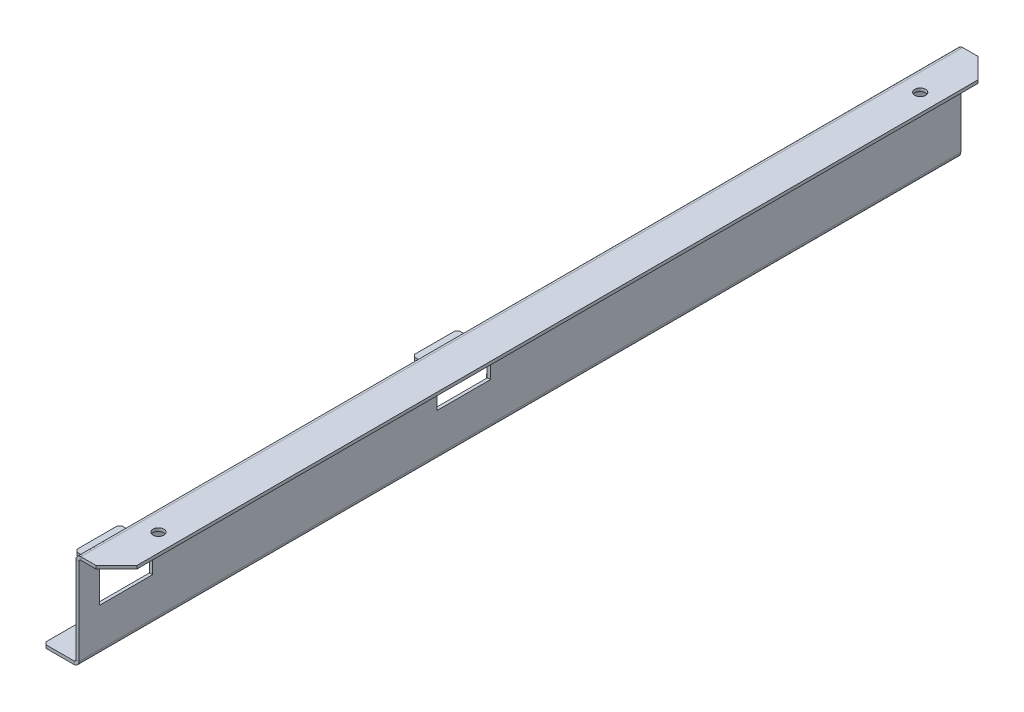
from build123d import *

# Parameters (mm, degrees)
SKETCH2_W                            = 16
SKETCH2_H                            = 38.1
BOSS_EXTRUDE1_DEPTH                  = 173.482
CONVERT_SOLID1_START                 = -173.482
CONVERT_SOLID1_DEPTH                 = 346.964
EDGE_FLANGE2_STRIP_W                 = 6.4008
EDGE_FLANGE2_STRIP_H                 = 1.2192
EDGE_FLANGE2_STRIP_CUT_DEPTH         = 346.964
EDGE_FLANGE2_DEPTH                   = 346.964
EDGE_FLANGE3_STRIP_W                 = 6.4008
EDGE_FLANGE3_STRIP_H                 = 1.2192
EDGE_FLANGE3_STRIP_CUT_DEPTH         = 172.6946
EDGE_FLANGE3_RELIEF_W                = 7.1628
EDGE_FLANGE3_RELIEF_H                = 1.6002
EDGE_FLANGE3_RELIEF_CUT_DEPTH        = 1.2192
EDGE_FLANGE3_DEPTH                   = 172.6946
PEM_CLEARANCE_HOLES_R                = 2.3876
CUT_EXTRUDE4_DEPTH                   = 179.335678775
TOP_PLATE_ATTACHMENT_PEM_HOLES_R     = 2.1082
CUT_EXTRUDE5_DEPTH                   = 179.335678775
CHAMFER2_SIZE                        = 8
SKETCH17_W                           = 20.9804
SKETCH17_H                           = 12.1158
CUT_EXTRUDE7_DEPTH                   = 1.2192
EDGE_FLANGE4_STRIP_W                 = 6.4008
EDGE_FLANGE4_STRIP_H                 = 1.2192
EDGE_FLANGE4_STRIP_CUT_DEPTH         = 17.78
EDGE_FLANGE4_RELIEF_W                = 7.1628
EDGE_FLANGE4_RELIEF_H                = 1.6002
EDGE_FLANGE4_RELIEF_CUT_DEPTH        = 1.2192
EDGE_FLANGE4_STRIP_2_W               = 6.4008
EDGE_FLANGE4_STRIP_2_H               = 1.2192
EDGE_FLANGE4_STRIP_CUT_2_DEPTH       = 17.78
EDGE_FLANGE4_RELIEF_2_W              = 7.1628
EDGE_FLANGE4_RELIEF_2_H              = 1.6002
EDGE_FLANGE4_RELIEF_CUT_2_DEPTH      = 1.2192
EDGE_FLANGE4_DEPTH                   = 17.78
EDGE_FLANGE4_BEND_DEPTH              = 17.78
BASE_MOUNTING_RIVET_CLAMPING_HOLES_R = 1.6637
CUT_EXTRUDE8_DEPTH                   = 1.2192
SKETCH29_R                           = 1.905
CUT_EXTRUDE11_DEPTH                  = 179.335678775
CHAMFER3_SIZE                        = 1.016


# Read off the part's stored shape, not the designer's step: Convert-Solid1
# Sheet-metal steps are written as plain solids
with BuildPart() as part:
    # Sketch2 → Boss-Extrude1 (new, symmetric)
    with BuildSketch(Plane.XY):
        with Locations((8, 19.05)):
            Rectangle(SKETCH2_W, SKETCH2_H)
    extrude(amount=BOSS_EXTRUDE1_DEPTH, both=True)

    # Convert-Solid1 outline → Convert-Solid1 (cut)
    with BuildSketch(Plane.XY.offset(CONVERT_SOLID1_START)):
        with BuildLine():
            Line((0, 38.1), (0, 36.1188))
            ThreePointArc((0, 36.1188), (0.580280045, 37.519719955), (1.9812, 38.1))
            Line((1.9812, 38.1), (0, 38.1))
        make_face()
        with BuildLine():
            Line((1.2192, 36.1188), (1.2192, 0))
            Line((1.2192, 0), (16, 0))
            Line((16, 0), (16, 36.8808))
            Line((16, 36.8808), (1.9812, 36.8808))
            ThreePointArc((1.9812, 36.8808), (1.442384633, 36.657615367), (1.2192, 36.1188))
        make_face()
    extrude(amount=CONVERT_SOLID1_DEPTH, mode=Mode.SUBTRACT)

    # Edge-Flange2 strip (across the edge) → Edge-Flange2 strip cut (cut)
    with BuildSketch(Plane(origin=(0, 0, -173.482), x_dir=(0, 1, 0), z_dir=(0, 0, 1))):
        with Locations((-1.2192, -0.6096)):
            Rectangle(EDGE_FLANGE2_STRIP_W, EDGE_FLANGE2_STRIP_H)
    extrude(amount=EDGE_FLANGE2_STRIP_CUT_DEPTH, mode=Mode.SUBTRACT)

    # Edge-Flange2 section (across the edge) → Edge-Flange2 (add)
    with BuildSketch(Plane(origin=(0, 0, -173.482), x_dir=(0, 1, 0), z_dir=(0, 0, 1))):
        with BuildLine():
            Line((0, 0.762), (0, 12.7508))
            Line((0, 12.7508), (1.2192, 12.7508))
            Line((1.2192, 12.7508), (1.2192, 0.762))
            ThreePointArc((1.2192, 0.762), (1.442384633, 0.223184633), (1.9812, 0))
            Line((1.9812, 0), (1.9812, -1.2192))
            ThreePointArc((1.9812, -1.2192), (0.580280045, -0.638919955), (0, 0.762))
        make_face()
    extrude(amount=EDGE_FLANGE2_DEPTH)

    # Edge-Flange3 strip (across the edge) → Edge-Flange3 strip cut (cut)
    with BuildSketch(Plane(origin=(-12.7508, 1.2192, -173.482), x_dir=(1, 0, 0), z_dir=(0, 0, 1))):
        with Locations((-1.2192, -0.6096)):
            Rectangle(EDGE_FLANGE3_STRIP_W, EDGE_FLANGE3_STRIP_H)
    extrude(amount=EDGE_FLANGE3_STRIP_CUT_DEPTH, mode=Mode.SUBTRACT)

    # Edge-Flange3 relief (on the sheet) → Edge-Flange3 relief cut (cut)
    with BuildSketch(Plane(origin=(-10.7696, 1.2192, -173.482), x_dir=(1, 0, 0), z_dir=(0, 1, 0))):
        with Locations((-2.8194, -173.4947)):
            Rectangle(EDGE_FLANGE3_RELIEF_W, EDGE_FLANGE3_RELIEF_H)
    extrude(amount=-EDGE_FLANGE3_RELIEF_CUT_DEPTH, mode=Mode.SUBTRACT)

    # Edge-Flange3 section (across the edge) → Edge-Flange3 (add)
    with BuildSketch(Plane(origin=(-12.7508, 1.2192, -173.482), x_dir=(1, 0, 0), z_dir=(0, 0, 1))):
        with BuildLine():
            Line((0, 0.762), (0, 5.6388))
            Line((0, 5.6388), (1.2192, 5.6388))
            Line((1.2192, 5.6388), (1.2192, 0.762))
            ThreePointArc((1.2192, 0.762), (1.442384633, 0.223184633), (1.9812, 0))
            Line((1.9812, 0), (1.9812, -1.2192))
            ThreePointArc((1.9812, -1.2192), (0.580280045, -0.638919955), (0, 0.762))
        make_face()
    extrude(amount=EDGE_FLANGE3_DEPTH)

    # PEM Clearance Holes → Cut-Extrude4 (cut, through all)
    with BuildSketch(Plane(origin=(0, 0, 0), x_dir=(1, 0, 0), z_dir=(0, 1, 0))):
        with Locations((-5.588, 22.098)):
            Circle(PEM_CLEARANCE_HOLES_R)
        with Locations((-5.588, 154.94)):
            Circle(PEM_CLEARANCE_HOLES_R)
        with Locations(Location((-5.588, -154.94, 0), (0, 0, 90))):
            Circle(PEM_CLEARANCE_HOLES_R)
        with Locations(Location((-5.588, -22.098, 0), (0, 0, 90))):
            Circle(PEM_CLEARANCE_HOLES_R)
    extrude(amount=CUT_EXTRUDE4_DEPTH, mode=Mode.SUBTRACT)

    # Top Plate Attachment PEM Holes → Cut-Extrude5 (cut, through all)
    with BuildSketch(Plane(origin=(0, 0, 0), x_dir=(1, 0, 0), z_dir=(0, 1, 0))):
        with Locations((8.89, -149.86)):
            Circle(TOP_PLATE_ATTACHMENT_PEM_HOLES_R)
        with Locations(Location((8.89, 149.86, 0), (0, 0, 90))):
            Circle(TOP_PLATE_ATTACHMENT_PEM_HOLES_R)
    extrude(amount=CUT_EXTRUDE5_DEPTH, mode=Mode.SUBTRACT)

    # Chamfer2
    chamfer2_edges = [part.edges().sort_by_distance(p)[0] for p in [
        (16, 37.4904, -173.482),
        (16, 37.4904, 173.482),
    ]]
    chamfer(chamfer2_edges, length=CHAMFER2_SIZE)

    # Sketch17 → Cut-Extrude7 (cut)
    with BuildSketch(Plane(origin=(0, 0, 0), x_dir=(0, 0, -1), z_dir=(1, 0, 0))):
        with Locations((-22.098, 23.1521)):
            Rectangle(SKETCH17_W, SKETCH17_H)
        with Locations((-154.94, 23.1521)):
            Rectangle(SKETCH17_W, SKETCH17_H)
    extrude(amount=CUT_EXTRUDE7_DEPTH, mode=Mode.SUBTRACT)

    # Edge-Flange4 strip (across the edge) → Edge-Flange4 strip cut (cut)
    with BuildSketch(Plane(origin=(0, 29.21, 13.208), x_dir=(0, 1, 0), z_dir=(0, 0, 1))):
        with Locations((-2.4384, -0.6096)):
            Rectangle(EDGE_FLANGE4_STRIP_W, EDGE_FLANGE4_STRIP_H)
    extrude(amount=EDGE_FLANGE4_STRIP_CUT_DEPTH, mode=Mode.SUBTRACT)

    # Edge-Flange4 relief (on the sheet) → Edge-Flange4 relief cut (cut)
    with BuildSketch(Plane(origin=(0, 29.972, 13.208), x_dir=(0, 1, 0), z_dir=(-1, 0, 0))):
        with Locations((-2.8194, 0.8001)):
            Rectangle(EDGE_FLANGE4_RELIEF_W, EDGE_FLANGE4_RELIEF_H)
        with Locations((-2.8194, -18.5801)):
            Rectangle(EDGE_FLANGE4_RELIEF_W, EDGE_FLANGE4_RELIEF_H)
    extrude(amount=-EDGE_FLANGE4_RELIEF_CUT_DEPTH, mode=Mode.SUBTRACT)

    # Edge-Flange4 strip 2 (across the edge) → Edge-Flange4 strip cut 2 (cut)
    with BuildSketch(Plane(origin=(0, 29.21, 146.05), x_dir=(0, 1, 0), z_dir=(0, 0, 1))):
        with Locations((-2.4384, -0.6096)):
            Rectangle(EDGE_FLANGE4_STRIP_2_W, EDGE_FLANGE4_STRIP_2_H)
    extrude(amount=EDGE_FLANGE4_STRIP_CUT_2_DEPTH, mode=Mode.SUBTRACT)

    # Edge-Flange4 relief 2 (on the sheet) → Edge-Flange4 relief cut 2 (cut)
    with BuildSketch(Plane(origin=(0, 29.972, 146.05), x_dir=(0, 1, 0), z_dir=(-1, 0, 0))):
        with Locations((-2.8194, 0.8001)):
            Rectangle(EDGE_FLANGE4_RELIEF_2_W, EDGE_FLANGE4_RELIEF_2_H)
        with Locations((-2.8194, -18.5801)):
            Rectangle(EDGE_FLANGE4_RELIEF_2_W, EDGE_FLANGE4_RELIEF_2_H)
    extrude(amount=-EDGE_FLANGE4_RELIEF_CUT_2_DEPTH, mode=Mode.SUBTRACT)

    # Edge-Flange4 section (across the edge) → Edge-Flange4 (add)
    with BuildSketch(Plane(origin=(0, 29.21, 13.208), x_dir=(0, 1, 0), z_dir=(0, 0, 1))):
        with BuildLine():
            Line((-1.2192, 0.762), (-1.2192, 10.2108))
            Line((-1.2192, 10.2108), (0, 10.2108))
            Line((0, 10.2108), (0, 0.762))
            ThreePointArc((0, 0.762), (0.223184633, 0.223184633), (0.762, 0))
            Line((0.762, 0), (0.762, -1.2192))
            ThreePointArc((0.762, -1.2192), (-0.638919955, -0.638919955), (-1.2192, 0.762))
        make_face()
    extrude(amount=EDGE_FLANGE4_DEPTH)

    # Edge-Flange4 section 2 (across the edge) → Edge-Flange4 bend (add)
    with BuildSketch(Plane(origin=(0, 29.21, 146.05), x_dir=(0, 1, 0), z_dir=(0, 0, 1))):
        with BuildLine():
            Line((-1.2192, 0.762), (-1.2192, 10.2108))
            Line((-1.2192, 10.2108), (0, 10.2108))
            Line((0, 10.2108), (0, 0.762))
            ThreePointArc((0, 0.762), (0.223184633, 0.223184633), (0.762, 0))
            Line((0.762, 0), (0.762, -1.2192))
            ThreePointArc((0.762, -1.2192), (-0.638919955, -0.638919955), (-1.2192, 0.762))
        make_face()
    extrude(amount=EDGE_FLANGE4_BEND_DEPTH)

    # Base Mounting Rivet Clamping Holes → Cut-Extrude8 (cut)
    with BuildSketch(Plane(origin=(0, 0, 0), x_dir=(1, 0, 0), z_dir=(0, 1, 0))):
        with Locations(Location((-5.588, -165.1, 0), (0, 0, 90))):
            Circle(BASE_MOUNTING_RIVET_CLAMPING_HOLES_R)
        with Locations(Location((-5.588, 0, 0), (0, 0, 270))):
            Circle(BASE_MOUNTING_RIVET_CLAMPING_HOLES_R)
        with Locations(Location((-5.588, 165.1, 0), (0, 0, 270))):
            Circle(BASE_MOUNTING_RIVET_CLAMPING_HOLES_R)
    extrude(amount=CUT_EXTRUDE8_DEPTH, mode=Mode.SUBTRACT)

    # Sketch29 → Cut-Extrude11 (cut, through all)
    with BuildSketch(Plane(origin=(0, 0, 0), x_dir=(1, 0, 0), z_dir=(0, 1, 0))):
        with Locations((-5.588, -22.098)):
            Circle(SKETCH29_R)
        with Locations(Location((-5.588, -154.94, 0), (0, 0, 180))):
            Circle(SKETCH29_R)
    extrude(amount=CUT_EXTRUDE11_DEPTH, mode=Mode.SUBTRACT)

    # Chamfer3
    chamfer3_edges = [part.edges().sort_by_distance(p)[0] for p in [
        (-10.2108, 28.6004, 13.208),
        (-10.2108, 28.6004, 30.988),
        (-10.2108, 28.6004, 146.05),
        (-10.2108, 28.6004, 163.83),
        (-12.7508, 0.6096, 173.482),
        (-12.7508, 0.6096, 0.8128),
        (-12.1412, 6.858, -173.482),
        (-12.1412, 6.858, -0.7874),
    ]]
    chamfer(chamfer3_edges, length=CHAMFER3_SIZE)


solid = part.part
